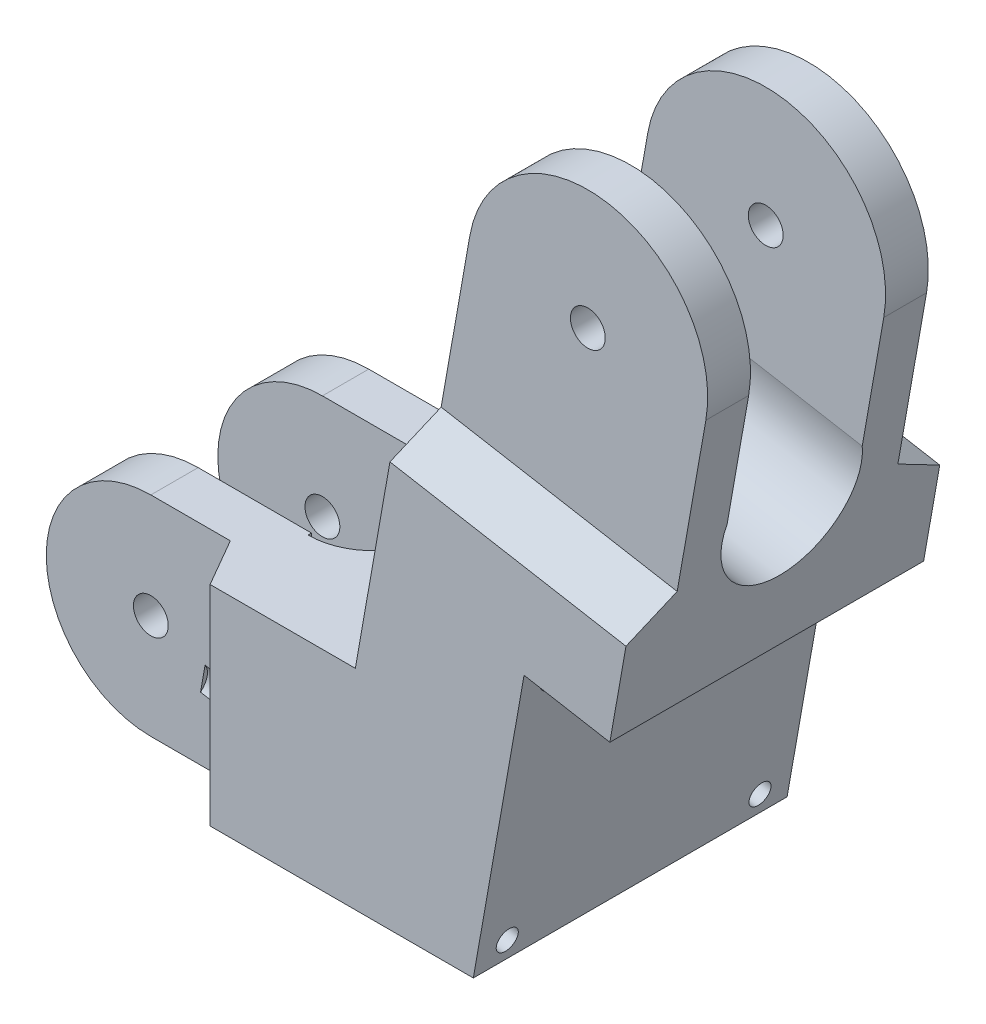
from build123d import *

# Parameters (mm, degrees)
BOSS_EXTRUDE1_DEPTH = 72
CUT_EXTRUDE1_DEPTH  = 72
SKETCH4_W           = 26
SKETCH4_H           = 28.511973983
SKETCH4_W_2         = 24
CUT_EXTRUDE2_DEPTH  = 72
CUT_EXTRUDE3_DEPTH  = 72
CUT_EXTRUDE4_DEPTH  = 72
SKETCH10_R          = 4
CUT_EXTRUDE5_DEPTH  = 72
SKETCH9_R           = 4
CUT_EXTRUDE6_DEPTH  = 72
SKETCH11_R          = 2.5
CUT_EXTRUDE7_DEPTH  = 100
SKETCH15_R          = 5
CUT_EXTRUDE9_DEPTH  = 20


# Read off the part's stored shape, not the designer's step: Boss-Extrude1
with BuildPart() as part:
    # Boss-Extrude1 outline → Boss-Extrude1 (new body)
    with BuildSketch(Plane.XY):
        with BuildLine():
            Line((62.494511824, 50.937989443), (82.190666884, 47.46502589))
            Line((82.190666884, 47.46502589), (93.534081641, 111.796727777))
            ThreePointArc((93.534081641, 111.796727777), (71.22719332, 143.654265871), (39.369655226, 121.347377549))
            Line((39.369655226, 121.347377549), (23.783847578, 32.955869992))
            Line((23.783847578, 32.955869992), (-34.13991608, 32.955869992))
            ThreePointArc((-34.13991608, 32.955869992), (-58.13991608, 8.955869992), (-34.13991608, -15.044130008))
            Line((-34.13991608, -15.044130008), (50.86008392, -15.044130008))
            Line((50.86008392, -15.044130008), (62.494511824, 50.937989443))
        make_face()
    extrude(amount=BOSS_EXTRUDE1_DEPTH)

    # Sketch3 → Cut-Extrude1 (cut)
    with BuildSketch(Plane(origin=(0, 32.955869992, 0), x_dir=(1, 0, 0), z_dir=(0, 1, 0))):
        Polygon((-9.823766264, 0), (-16.174619225, -11), (-58.13991608, -11), (-58.13991608, 0), align=None)
        Polygon((-9.54918364, -72), (-15.900036601, -61), (-58.13991608, -61), (-58.13991608, -72), align=None)
    extrude(amount=-CUT_EXTRUDE1_DEPTH, mode=Mode.SUBTRACT)

    # Sketch4 → Cut-Extrude2 (cut)
    with BuildSketch(Plane(origin=(0, 32.955869992, 0), x_dir=(1, 0, 0), z_dir=(0, 1, 0))):
        with Locations((-21.13991608, -35.889301659)):
            Rectangle(SKETCH4_W, SKETCH4_H)
        with Locations((-46.13991608, -35.889301659)):
            Rectangle(SKETCH4_W_2, SKETCH4_H)
        with BuildLine():
            ThreePointArc((-8.13991608, -20.833314667), (6.916070911, -35.889301658), (-8.13991608, -50.94528865))
            Line((-8.13991608, -50.94528865), (-8.13991608, -20.833314667))
        make_face()
    extrude(amount=-CUT_EXTRUDE2_DEPTH, mode=Mode.SUBTRACT)

    # Sketch5 → Cut-Extrude3 (cut)
    with BuildSketch(Plane(origin=(71.595317547, -12.624186176, 0), x_dir=(0, 0, -1), z_dir=(0.9848077530122087, -0.173648177666927, 0))):
        Polygon((-72, 82.273588595), (-61.318633323, 88.440478521), (-61.318633323, 153.840307103), (-72, 153.840307103), align=None)
        Polygon((0, 82.273588595), (-10.681366677, 88.440478521), (-10.681366677, 153.840307103), (0, 153.840307103), align=None)
    extrude(amount=-CUT_EXTRUDE3_DEPTH, mode=Mode.SUBTRACT)

    # Sketch7 → Cut-Extrude4 (cut)
    with BuildSketch(Plane(origin=(71.595317547, -12.624186176, 0), x_dir=(0, 0, -1), z_dir=(0.9848077530122087, -0.173648177666927, 0))):
        with BuildLine():
            Line((-51.5, 97.883463974), (-51.5, 153.840307103))
            Line((-51.5, 153.840307103), (-20.5, 153.840307103))
            Line((-20.5, 153.840307103), (-20.5, 97.883463974))
            ThreePointArc((-20.5, 97.883463974), (-36, 77.914837007), (-51.5, 97.883463974))
        make_face()
    extrude(amount=-CUT_EXTRUDE4_DEPTH, mode=Mode.SUBTRACT)

    # Sketch10 → Cut-Extrude5 (cut)
    with BuildSketch(Plane(origin=(0, 0, 10.681366677), x_dir=(-1, 0, 0), z_dir=(0, 0, -1))):
        with Locations((-66.451868434, 116.572052663)):
            Circle(SKETCH10_R)
    extrude(amount=-CUT_EXTRUDE5_DEPTH, mode=Mode.SUBTRACT)

    # Sketch9 → Cut-Extrude6 (cut)
    with BuildSketch(Plane(origin=(0, 0, 11), x_dir=(-1, 0, 0), z_dir=(0, 0, -1))):
        with Locations((34.13991608, 8.955869992)):
            Circle(SKETCH9_R)
    extrude(amount=-CUT_EXTRUDE6_DEPTH, mode=Mode.SUBTRACT)

    # Sketch11 → Cut-Extrude7 (cut)
    with BuildSketch(Plane(origin=(51.899162487, -9.151222623, 0), x_dir=(0, 0, -1), z_dir=(0.9848077530122088, -0.17364817766692606, 0))):
        with Locations(Location((-7, -1.483814981, 0), (0, 0, 90))):
            Circle(SKETCH11_R)
        with Locations(Location((-65, -1.483814981, 0), (0, 0, 90))):
            Circle(SKETCH11_R)
        with Locations(Location((-7, 56.516185019, 0), (0, 0, 90))):
            Circle(SKETCH11_R)
        with Locations(Location((-65, 56.516185019, 0), (0, 0, 90))):
            Circle(SKETCH11_R)
    extrude(amount=-CUT_EXTRUDE7_DEPTH, mode=Mode.SUBTRACT)

    # Sketch15 → Cut-Extrude9 (cut)
    with BuildSketch(Plane(origin=(-21.961418989, 3.872390702, 0), x_dir=(0, 0, 1), z_dir=(-0.9848077530122088, 0.17364817766692614, 0))):
        with Locations(Location((7, -1.483814981, 0), (0, 0, 270))):
            Circle(SKETCH15_R)
        with Locations(Location((65, -1.483814981, 0), (0, 0, 270))):
            Circle(SKETCH15_R)
    extrude(amount=-CUT_EXTRUDE9_DEPTH, mode=Mode.SUBTRACT)


solid = part.part
